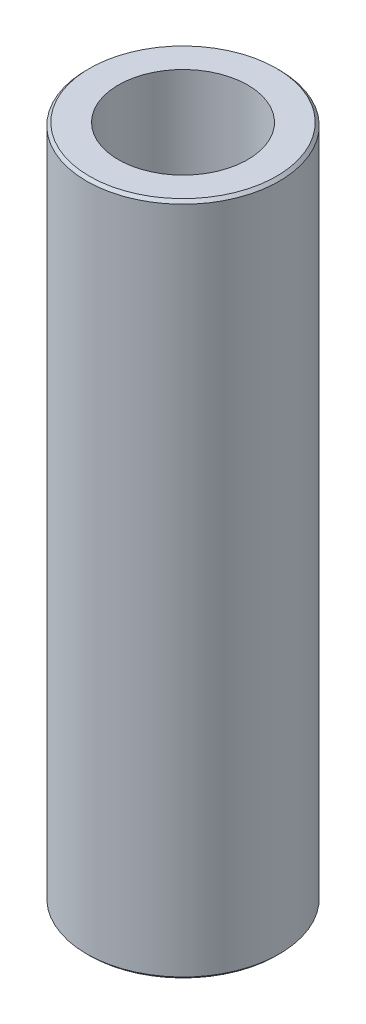
from build123d import *

# Parameters (mm, degrees)
SKETCH1_R           = 35
BOSS_EXTRUDE1_DEPTH = 245.194889597
SKETCH2_R           = 23.509863143
CUT_EXTRUDE1_DEPTH  = 251.141027991
CHAMFER1_SIZE       = 1.032429688


with BuildPart() as part:
    # Sketch1 → Boss-Extrude1 (new body)
    with BuildSketch(Plane(origin=(0, 0, 0), x_dir=(1, 0, 0), z_dir=(0, 1, 0))):
        Circle(SKETCH1_R)
    extrude(amount=BOSS_EXTRUDE1_DEPTH)

    # Sketch2 → Cut-Extrude1 (cut, through all)
    with BuildSketch(Plane(origin=(0, 0, 0), x_dir=(1, 0, 0), z_dir=(0, 1, 0))):
        Circle(SKETCH2_R)
    extrude(amount=CUT_EXTRUDE1_DEPTH, mode=Mode.SUBTRACT)

    # Chamfer1
    chamfer1_edges = [part.edges().sort_by_distance(p)[0] for p in [
        (-35, 245.194889597, 0),
        (-35, 0, 0),
    ]]
    chamfer(chamfer1_edges, length=CHAMFER1_SIZE)


solid = part.part
